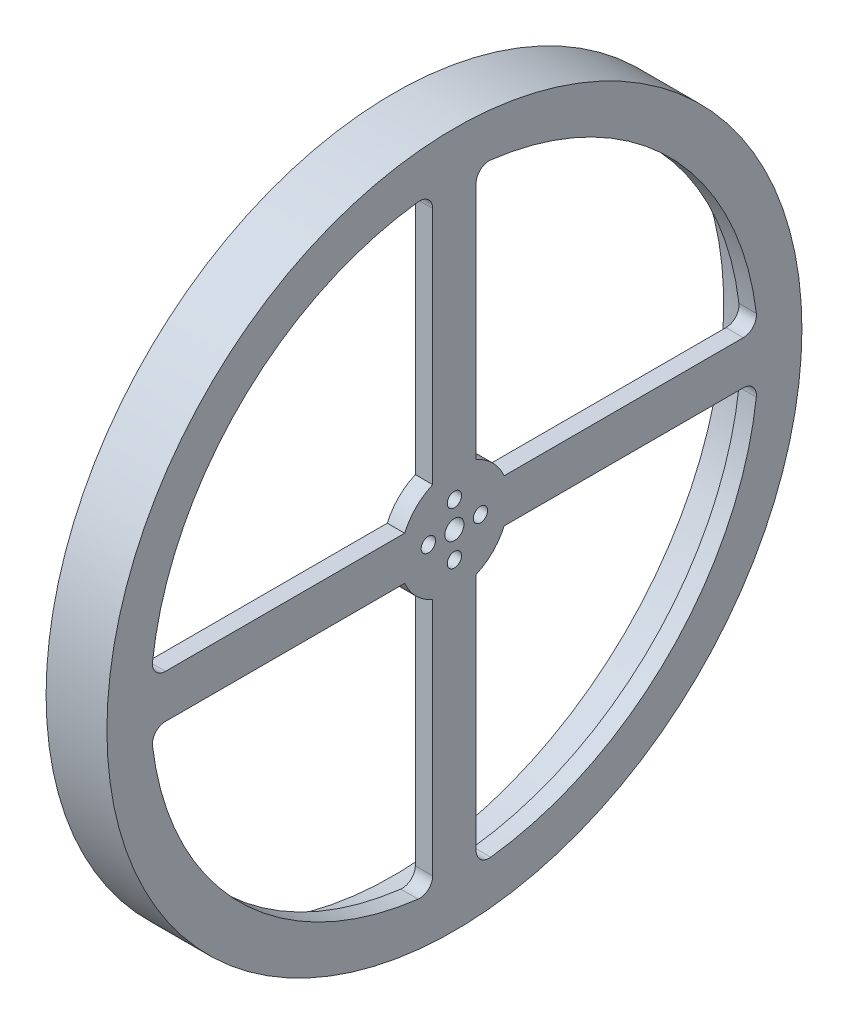
from build123d import *

# Parameters (mm, degrees)
SKETCH3_R           = 80
BOSS_EXTRUDE3_DEPTH = 4
SKETCH5_R           = 1.65
CUT_EXTRUDE3_DEPTH  = 114.207773585
CUT_EXTRUDE4_DEPTH  = 114.207773585
CIRPATTERN2_COUNT   = 4
FILLET2_R           = 3
BOSS_EXTRUDE4_START = 10
SKETCH7_R           = 80
SKETCH7_R_2         = 76
BOSS_EXTRUDE4_DEPTH = 10
SKETCH8_R           = 2.2
CUT_EXTRUDE5_DEPTH  = 115


with BuildPart() as part:
    # Sketch3 → Boss-Extrude3 (new body)
    with BuildSketch(Plane.YZ):
        Circle(SKETCH3_R)
    extrude(amount=BOSS_EXTRUDE3_DEPTH)

    # Sketch5 → Cut-Extrude3 (cut, through all)
    with BuildSketch(Plane.YZ.offset(4)):
        with Locations((0, 6)):
            Circle(SKETCH5_R)
        with Locations((6, 0)):
            Circle(SKETCH5_R)
        with Locations((0, -6)):
            Circle(SKETCH5_R)
        with Locations((-6, 0)):
            Circle(SKETCH5_R)
    extrude(amount=-CUT_EXTRUDE3_DEPTH, mode=Mode.SUBTRACT)

    # Sketch6 → Cut-Extrude4 (cut, through all)
    with BuildSketch(Plane.YZ.offset(4)):
        with BuildLine():
            Line((11.456439237, 5), (69.821200219, 5))
            ThreePointArc((69.821200219, 5), (49.497474683, 49.497474683), (5, 69.821200219))
            Line((5, 69.821200219), (5, 11.456439237))
            ThreePointArc((5, 11.456439237), (8.838834765, 8.838834765), (11.456439237, 5))
        make_face()
    cut_extrude4 = extrude(amount=-CUT_EXTRUDE4_DEPTH, mode=Mode.SUBTRACT)

    # CirPattern2: Cut-Extrude4 ×4 about axis
    cirpattern2_axis = Axis((4, 0, 0), (-1, 0, 0))
    for i in range(1, CIRPATTERN2_COUNT):
        add(cut_extrude4.rotate(cirpattern2_axis, i * 360 / CIRPATTERN2_COUNT), mode=Mode.SUBTRACT)

    # Fillet2
    fillet2_edges = [part.edges().sort_by_distance(p)[0] for p in [
        (2, -5, 69.821200219),
        (2, 5, 69.821200219),
        (2, -69.821200219, 5),
        (2, -69.821200219, -5),
        (2, -5, -69.821200219),
        (2, 5, -69.821200219),
        (2, 69.821200219, -5),
        (2, 69.821200219, 5),
    ]]
    fillet(fillet2_edges, radius=FILLET2_R)

    # Sketch7 → Boss-Extrude4 (add)
    with BuildSketch(Plane(origin=(0, 0, 0), x_dir=(0, -1, 0), z_dir=(-1, 0, 0)).offset(BOSS_EXTRUDE4_START)):
        Circle(SKETCH7_R)
        Circle(SKETCH7_R_2, mode=Mode.SUBTRACT)
    extrude(amount=-BOSS_EXTRUDE4_DEPTH)

    # Sketch8 → Cut-Extrude5 (cut, through all)
    with BuildSketch(Plane.YZ.offset(4)):
        Circle(SKETCH8_R)
    extrude(amount=-CUT_EXTRUDE5_DEPTH, mode=Mode.SUBTRACT)


solid = part.part
